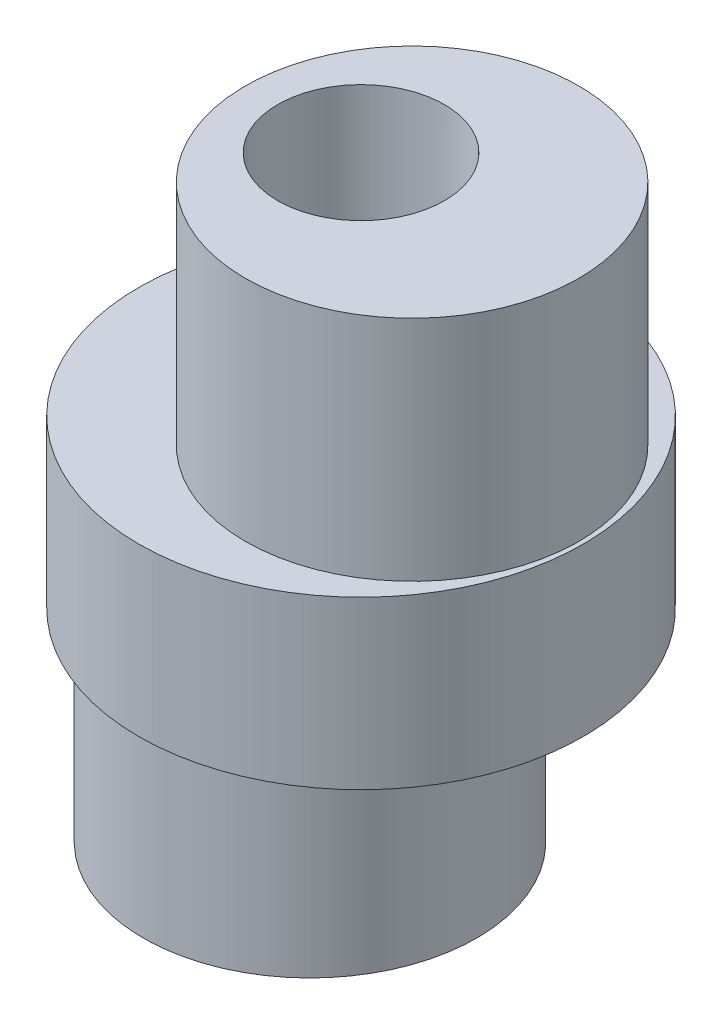
from build123d import *

# Parameters (mm, degrees)
SKETCH1_R           = 8
BOSS_EXTRUDE1_DEPTH = 6
SKETCH2_R           = 6
BOSS_EXTRUDE2_DEPTH = 8.2
SKETCH3_R           = 6
BOSS_EXTRUDE3_DEPTH = 8.2
SKETCH4_R           = 3
CUT_EXTRUDE1_DEPTH  = 15


with BuildPart() as part:
    # Sketch1 → Boss-Extrude1 (new body)
    with BuildSketch(Plane(origin=(0, 0, 0), x_dir=(1, 0, 0), z_dir=(0, 1, 0))):
        Circle(SKETCH1_R)
    extrude(amount=BOSS_EXTRUDE1_DEPTH)

    # Sketch2 → Boss-Extrude2 (add)
    with BuildSketch(Plane(origin=(0, 6, 0), x_dir=(1, 0, 0), z_dir=(0, 1, 0))):
        with Locations((1.8375, 0)):
            Circle(SKETCH2_R)
    extrude(amount=BOSS_EXTRUDE2_DEPTH)

    # Sketch3 → Boss-Extrude3 (add)
    with BuildSketch(Plane.XZ):
        with Locations((-1.8375, 0)):
            Circle(SKETCH3_R)
    extrude(amount=BOSS_EXTRUDE3_DEPTH)

    # Sketch4 → Cut-Extrude1 (cut, symmetric)
    with BuildSketch(Plane(origin=(0, 6, 0), x_dir=(1, 0, 0), z_dir=(0, 1, 0))):
        Circle(SKETCH4_R)
    extrude(amount=CUT_EXTRUDE1_DEPTH, both=True, mode=Mode.SUBTRACT)


solid = part.part
